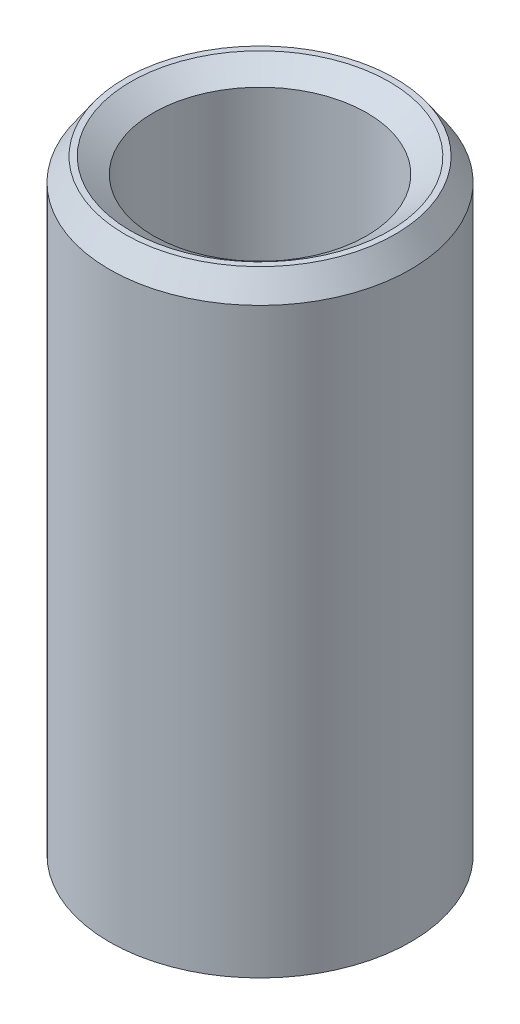
from build123d import *
from OCP.BRepFilletAPI import BRepFilletAPI_MakeChamfer

# Parameters (mm, degrees)
SKETCH1_R           = 15
BOSS_EXTRUDE1_DEPTH = 61.78262856
SKETCH2_R           = 10.61752401
CUT_EXTRUDE1_DEPTH  = 66.322991295
CHAMFER1_SIZE       = 2.251111253
CHAMFER1_SIZE2      = 1.548244353


with BuildPart() as part:
    # Sketch1 → Boss-Extrude1 (new body)
    with BuildSketch(Plane(origin=(0, 0, 0), x_dir=(1, 0, 0), z_dir=(0, 1, 0))):
        Circle(SKETCH1_R)
    extrude(amount=BOSS_EXTRUDE1_DEPTH)

    # Sketch2 → Cut-Extrude1 (cut, through all)
    with BuildSketch(Plane(origin=(0, 0, 0), x_dir=(1, 0, 0), z_dir=(0, 1, 0))):
        Circle(SKETCH2_R)
    extrude(amount=CUT_EXTRUDE1_DEPTH, mode=Mode.SUBTRACT)

    # Chamfer1: one chamfer whose edges measure the first distance from different faces: ONE call of the kernel's chamfer builder (chamfer() names one face for all edges)
    chamfer1_edges_1 = [part.edges().sort_by_distance(p)[0] for p in [
        (-10.61752401, 61.78262856, 0),
    ]]
    chamfer1_side_1 = [part.faces().sort_by_distance(p)[0] for p in [
        (-14.575735931, 61.78262856, 0),
    ]]
    chamfer1_edges_2 = [part.edges().sort_by_distance(p)[0] for p in [
        (-10.61752401, 0, 0),
    ]]
    chamfer1_side_2 = [part.faces().sort_by_distance(p)[0] for p in [
        (-10.61752401, 30.89131428, 0),
    ]]
    chamfer1_edges_3 = [part.edges().sort_by_distance(p)[0] for p in [
        (-15, 0, 0),
    ]]
    chamfer1_side_3 = [part.faces().sort_by_distance(p)[0] for p in [
        (-14.575735931, 0, 0),
    ]]
    chamfer1_edges_4 = [part.edges().sort_by_distance(p)[0] for p in [
        (-15, 61.78262856, 0),
    ]]
    chamfer1_side_4 = [part.faces().sort_by_distance(p)[0] for p in [
        (-15, 30.89131428, 0),
    ]]
    chamfer1 = BRepFilletAPI_MakeChamfer(part.part.solid().wrapped)
    for e in chamfer1_edges_1:
        chamfer1.Add(CHAMFER1_SIZE, CHAMFER1_SIZE2, e.wrapped, chamfer1_side_1[0].wrapped)  # the first distance lies on this face
    for e in chamfer1_edges_2:
        chamfer1.Add(CHAMFER1_SIZE, CHAMFER1_SIZE2, e.wrapped, chamfer1_side_2[0].wrapped)  # the first distance lies on this face
    for e in chamfer1_edges_3:
        chamfer1.Add(CHAMFER1_SIZE, CHAMFER1_SIZE2, e.wrapped, chamfer1_side_3[0].wrapped)  # the first distance lies on this face
    for e in chamfer1_edges_4:
        chamfer1.Add(CHAMFER1_SIZE, CHAMFER1_SIZE2, e.wrapped, chamfer1_side_4[0].wrapped)  # the first distance lies on this face
    add(Compound.cast(chamfer1.Shape()), mode=Mode.REPLACE)


solid = part.part
